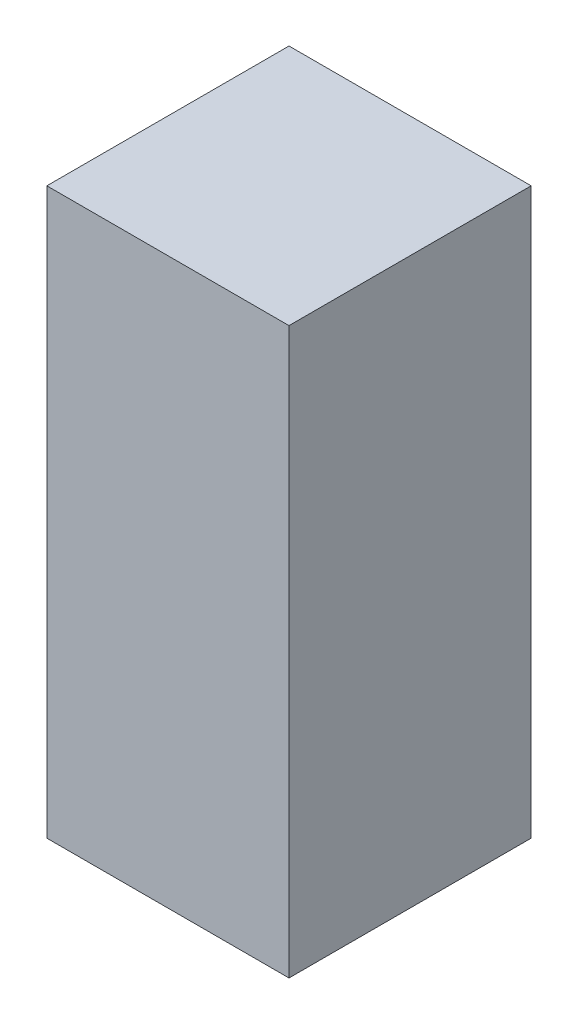
from build123d import *

# Parameters (mm, degrees)
SKETCH1_W           = 77
SKETCH1_H           = 33
BOSS_EXTRUDE1_DEPTH = 33


with BuildPart() as part:
    # Sketch1 → Boss-Extrude1 (new body)
    with BuildSketch(Plane(origin=(0, 0, 0), x_dir=(0, 1, 0), z_dir=(0, 0, 1))):
        with Locations((38.5, 16.5)):
            Rectangle(SKETCH1_W, SKETCH1_H)
    extrude(amount=BOSS_EXTRUDE1_DEPTH)


solid = part.part
